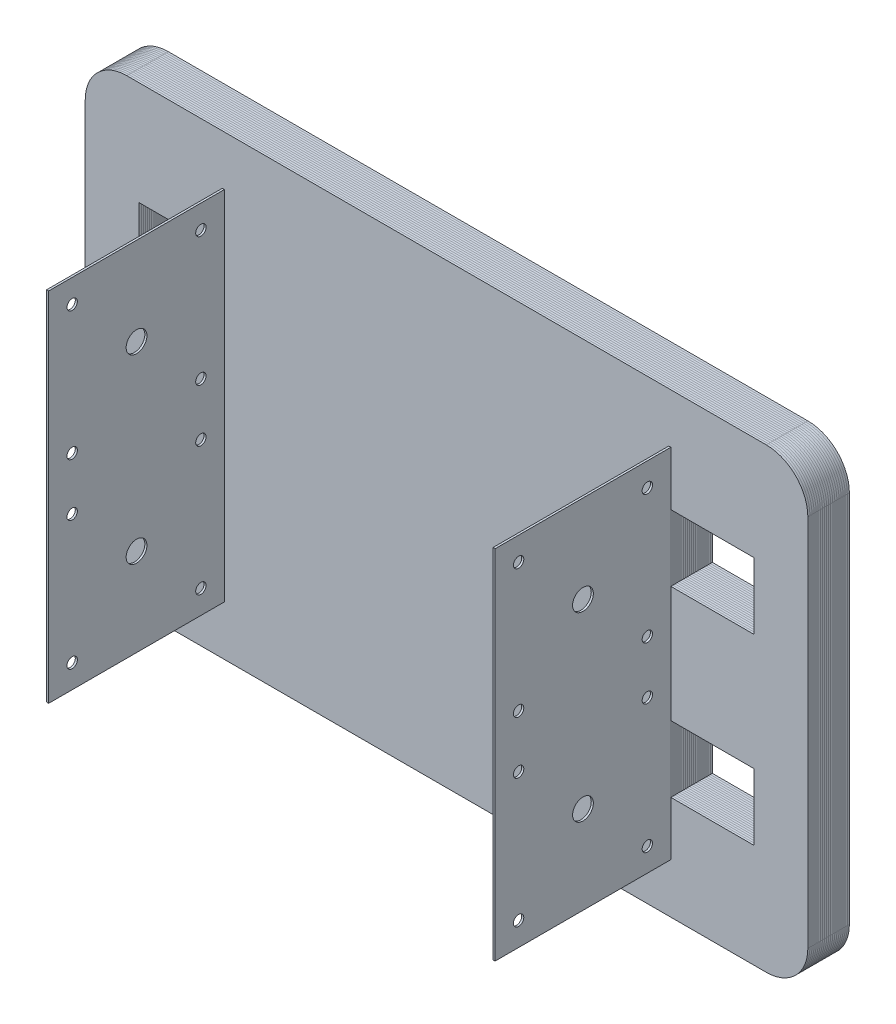
from build123d import *

# Parameters (mm, degrees)
ESBO_O2_W                                    = 20
ESBO_O2_H                                    = 16
RESSALTO_EXTRUS_O8_DEPTH                     = 0.5
ESBO_O2_13_W                                 = 0.5
ESBO_O2_13_H                                 = 86
RESSALTO_EXTRUS_O9_DEPTH                     = 42.3
RESSALTO_EXTRUS_O9_2_DEPTH                   = 42.3
BROCA_DE_ROSQUEAR_PARA_TARRAXA_DE_M3_2_COUNT = 2
BROCA_DE_ROSQUEAR_PARA_TARRAXA_DE_M3_2_PITCH = 31
BROCA_DE_ROSQUEAR_PARA_TARRAXA_DE_M3_3_COUNT = 2
BROCA_DE_ROSQUEAR_PARA_TARRAXA_DE_M3_3_PITCH = 43.840620434
BROCA_DE_ROSQUEAR_PARA_TARRAXA_DE_M3_4_COUNT = 2
BROCA_DE_ROSQUEAR_PARA_TARRAXA_DE_M3_4_PITCH = 31
BROCA_DE_ROSQUEAR_PARA_TARRAXA_DE_M3_5_COUNT = 2
BROCA_DE_ROSQUEAR_PARA_TARRAXA_DE_M3_5_PITCH = 53.578820442
BROCA_DE_ROSQUEAR_PARA_TARRAXA_DE_M3_6_COUNT = 2
BROCA_DE_ROSQUEAR_PARA_TARRAXA_DE_M3_6_PITCH = 43.7
BROCA_DE_ROSQUEAR_PARA_TARRAXA_DE_M3_7_COUNT = 2
BROCA_DE_ROSQUEAR_PARA_TARRAXA_DE_M3_7_PITCH = 74.7
BROCA_DE_ROSQUEAR_PARA_TARRAXA_DE_M3_8_COUNT = 2
BROCA_DE_ROSQUEAR_PARA_TARRAXA_DE_M3_8_PITCH = 80.877005385
CORTE_EXTRUS_O2_DEPTH                        = 184.766944797
CORTE_EXTRUS_O2_DEPTH_BACK                   = 184.766944797
ESBO_O27_R                                   = 1.25
ESBO_O27_R_2                                 = 2.5
CORTE_EXTRUS_O3_DEPTH                        = 184.766944797
CORTE_EXTRUS_O3_DEPTH_BACK                   = 184.766944797
ESBO_O27_2_R                                 = 1.25
ESBO_O27_2_R_2                               = 2.5
ESBO_O28_W                                   = 20
ESBO_O28_H                                   = 16
RESSALTO_EXTRUS_O10_DEPTH                    = 0.5
ESBO_O29_W                                   = 20
ESBO_O29_H                                   = 16
RESSALTO_EXTRUS_O11_DEPTH                    = 0.5
ESBO_O30_W                                   = 20
ESBO_O30_H                                   = 16
RESSALTO_EXTRUS_O12_DEPTH                    = 0.5
ESBO_O31_W                                   = 20
ESBO_O31_H                                   = 16
RESSALTO_EXTRUS_O13_DEPTH                    = 0.5
ESBO_O32_W                                   = 20
ESBO_O32_H                                   = 16
RESSALTO_EXTRUS_O14_DEPTH                    = 0.5
ESBO_O33_W                                   = 20
ESBO_O33_H                                   = 16
RESSALTO_EXTRUS_O15_DEPTH                    = 0.5
ESBO_O34_W                                   = 20
ESBO_O34_H                                   = 16
RESSALTO_EXTRUS_O16_DEPTH                    = 0.5
ESBO_O35_W                                   = 20
ESBO_O35_H                                   = 16
RESSALTO_EXTRUS_O17_DEPTH                    = 0.5
ESBO_O36_W                                   = 20
ESBO_O36_H                                   = 16
RESSALTO_EXTRUS_O18_DEPTH                    = 0.5
ESBO_O37_W                                   = 20
ESBO_O37_H                                   = 16
RESSALTO_EXTRUS_O19_DEPTH                    = 0.5
ESBO_O38_W                                   = 20
ESBO_O38_H                                   = 16
RESSALTO_EXTRUS_O20_DEPTH                    = 0.5
ESBO_O39_W                                   = 20
ESBO_O39_H                                   = 16
RESSALTO_EXTRUS_O21_DEPTH                    = 0.5
ESBO_O40_W                                   = 20
ESBO_O40_H                                   = 16
RESSALTO_EXTRUS_O22_DEPTH                    = 0.5
ESBO_O41_W                                   = 20
ESBO_O41_H                                   = 16
RESSALTO_EXTRUS_O23_DEPTH                    = 0.5
ESBO_O42_W                                   = 20
ESBO_O42_H                                   = 16
RESSALTO_EXTRUS_O24_DEPTH                    = 0.5
ESBO_O43_W                                   = 20
ESBO_O43_H                                   = 16
RESSALTO_EXTRUS_O25_DEPTH                    = 0.5
ESBO_O46_W                                   = 20
ESBO_O46_H                                   = 16
RESSALTO_EXTRUS_O27_DEPTH                    = 0.5
ESBO_O47_W                                   = 20
ESBO_O47_H                                   = 16
RESSALTO_EXTRUS_O28_DEPTH                    = 0.5
ESBO_O48_W                                   = 20
ESBO_O48_H                                   = 16
RESSALTO_EXTRUS_O30_DEPTH                    = 0.5


with BuildPart() as part:
    # Esboço2 → Ressalto-extrusão8 (new body)
    with BuildSketch(Plane.XY):
        with BuildLine():
            Line((-164, 0), (-10, 0))
            ThreePointArc((-10, 0), (-2.928932188, 2.928932188), (0, 10))
            Line((0, 10), (0, 100))
            ThreePointArc((0, 100), (-2.928932188, 107.071067812), (-10, 110))
            Line((-10, 110), (-164, 110))
            ThreePointArc((-164, 110), (-171.071067812, 107.071067812), (-174, 100))
            Line((-174, 100), (-174, 10))
            ThreePointArc((-174, 10), (-171.071067812, 2.928932188), (-164, 0))
        make_face()
        with Locations((-151, 77)):
            Rectangle(ESBO_O2_W, ESBO_O2_H, mode=Mode.SUBTRACT)
        with Locations((-151, 33)):
            Rectangle(ESBO_O2_W, ESBO_O2_H, mode=Mode.SUBTRACT)
        with Locations((-23, 33)):
            Rectangle(ESBO_O2_W, ESBO_O2_H, mode=Mode.SUBTRACT)
        with Locations((-23, 77)):
            Rectangle(ESBO_O2_W, ESBO_O2_H, mode=Mode.SUBTRACT)
    extrude(amount=-RESSALTO_EXTRUS_O8_DEPTH)


with BuildPart() as body_2:
    # Esboço2<13> → Ressalto-extrusão9 (new body)
    with BuildSketch(Plane.XY):
        with Locations((-33.25, 55)):
            Rectangle(ESBO_O2_13_W, ESBO_O2_13_H)
    extrude(amount=RESSALTO_EXTRUS_O9_DEPTH)

    # Esboço27 → Corte-extrusão2 (cut, two sides: drawn at the far end of the back side and taken through both)
    with BuildSketch(Plane.ZY.offset(141).offset(-CORTE_EXTRUS_O2_DEPTH_BACK)):
        with Locations((5.65, 92.35)):
            Circle(ESBO_O27_R)
        with Locations((36.65, 92.35)):
            Circle(ESBO_O27_R)
        with Locations((5.65, 61.35)):
            Circle(ESBO_O27_R)
        with Locations((36.65, 61.35)):
            Circle(ESBO_O27_R)
        with Locations((5.65, 48.65)):
            Circle(ESBO_O27_R)
        with Locations((36.65, 48.65)):
            Circle(ESBO_O27_R)
        with Locations((5.65, 17.65)):
            Circle(ESBO_O27_R)
        with Locations((36.65, 17.65)):
            Circle(ESBO_O27_R)
        with Locations((21.15, 76.85)):
            Circle(ESBO_O27_R_2)
        with Locations((21.15, 33.15)):
            Circle(ESBO_O27_R_2)
    extrude(amount=CORTE_EXTRUS_O2_DEPTH + CORTE_EXTRUS_O2_DEPTH_BACK, mode=Mode.SUBTRACT)


with BuildPart() as body_3:
    # Esboço2<13> → Ressalto-extrus_o9 2 (new body)
    with BuildSketch(Plane.XY):
        with Locations((-140.75, 55)):
            Rectangle(ESBO_O2_13_W, ESBO_O2_13_H)
    extrude(amount=RESSALTO_EXTRUS_O9_2_DEPTH)

    # Esboço26 → Broca de rosquear para tarraxa de M3x0.51 (revolve, cut)
    with BuildSketch(Plane(origin=(-141, 92.35, 36.65), x_dir=(0, 0, 1), z_dir=(0, 1, 0))):
        Polygon((0, 0), (0, 25.4), (1.25, 24.648924226), (1.25, 0), align=None)
    broca_de_rosquear_para_tarraxa_de_m3x0_5 = revolve(axis=Axis((-147.35, 92.35, 36.65), (1, 0, 0)), mode=Mode.SUBTRACT)

    # Broca de rosquear para tarraxa de M3 2: Broca de rosquear para tarraxa de M3x0.51 ×2
    with Locations(*[(0, 0, -i * BROCA_DE_ROSQUEAR_PARA_TARRAXA_DE_M3_2_PITCH) for i in range(1, BROCA_DE_ROSQUEAR_PARA_TARRAXA_DE_M3_2_COUNT)]):
        add(broca_de_rosquear_para_tarraxa_de_m3x0_5, mode=Mode.SUBTRACT)

    # Broca de rosquear para tarraxa de M3 3: Broca de rosquear para tarraxa de M3x0.51 ×2
    with Locations(*[Vector(0, -0.7071067811865476, -0.7071067811865475) * (i * BROCA_DE_ROSQUEAR_PARA_TARRAXA_DE_M3_3_PITCH) for i in range(1, BROCA_DE_ROSQUEAR_PARA_TARRAXA_DE_M3_3_COUNT)]):
        add(broca_de_rosquear_para_tarraxa_de_m3x0_5, mode=Mode.SUBTRACT)

    # Broca de rosquear para tarraxa de M3 4: Broca de rosquear para tarraxa de M3x0.51 ×2
    with Locations(*[(0, -i * BROCA_DE_ROSQUEAR_PARA_TARRAXA_DE_M3_4_PITCH, 0) for i in range(1, BROCA_DE_ROSQUEAR_PARA_TARRAXA_DE_M3_4_COUNT)]):
        add(broca_de_rosquear_para_tarraxa_de_m3x0_5, mode=Mode.SUBTRACT)

    # Broca de rosquear para tarraxa de M3 5: Broca de rosquear para tarraxa de M3x0.51 ×2
    with Locations(*[Vector(0, -0.8156207926781761, -0.578586832334632) * (i * BROCA_DE_ROSQUEAR_PARA_TARRAXA_DE_M3_5_PITCH) for i in range(1, BROCA_DE_ROSQUEAR_PARA_TARRAXA_DE_M3_5_COUNT)]):
        add(broca_de_rosquear_para_tarraxa_de_m3x0_5, mode=Mode.SUBTRACT)

    # Broca de rosquear para tarraxa de M3 6: Broca de rosquear para tarraxa de M3x0.51 ×2
    with Locations(*[(0, -i * BROCA_DE_ROSQUEAR_PARA_TARRAXA_DE_M3_6_PITCH, 0) for i in range(1, BROCA_DE_ROSQUEAR_PARA_TARRAXA_DE_M3_6_COUNT)]):
        add(broca_de_rosquear_para_tarraxa_de_m3x0_5, mode=Mode.SUBTRACT)

    # Broca de rosquear para tarraxa de M3 7: Broca de rosquear para tarraxa de M3x0.51 ×2
    with Locations(*[(0, -i * BROCA_DE_ROSQUEAR_PARA_TARRAXA_DE_M3_7_PITCH, 0) for i in range(1, BROCA_DE_ROSQUEAR_PARA_TARRAXA_DE_M3_7_COUNT)]):
        add(broca_de_rosquear_para_tarraxa_de_m3x0_5, mode=Mode.SUBTRACT)

    # Broca de rosquear para tarraxa de M3 8: Broca de rosquear para tarraxa de M3x0.51 ×2
    with Locations(*[Vector(0, -0.9236247020356809, -0.383298069117886) * (i * BROCA_DE_ROSQUEAR_PARA_TARRAXA_DE_M3_8_PITCH) for i in range(1, BROCA_DE_ROSQUEAR_PARA_TARRAXA_DE_M3_8_COUNT)]):
        add(broca_de_rosquear_para_tarraxa_de_m3x0_5, mode=Mode.SUBTRACT)

    # Esboço27<2> → Corte-extrusão3 (cut, two sides: drawn at the far end of the back side and taken through both)
    with BuildSketch(Plane.ZY.offset(141).offset(-CORTE_EXTRUS_O3_DEPTH_BACK)):
        with Locations((5.65, 92.35)):
            Circle(ESBO_O27_2_R)
        with Locations((36.65, 92.35)):
            Circle(ESBO_O27_2_R)
        with Locations((5.65, 61.35)):
            Circle(ESBO_O27_2_R)
        with Locations((36.65, 61.35)):
            Circle(ESBO_O27_2_R)
        with Locations((5.65, 48.65)):
            Circle(ESBO_O27_2_R)
        with Locations((36.65, 48.65)):
            Circle(ESBO_O27_2_R)
        with Locations((5.65, 17.65)):
            Circle(ESBO_O27_2_R)
        with Locations((36.65, 17.65)):
            Circle(ESBO_O27_2_R)
        with Locations((21.15, 76.85)):
            Circle(ESBO_O27_2_R_2)
        with Locations((21.15, 33.15)):
            Circle(ESBO_O27_2_R_2)
    extrude(amount=CORTE_EXTRUS_O3_DEPTH + CORTE_EXTRUS_O3_DEPTH_BACK, mode=Mode.SUBTRACT)


with BuildPart() as body_4:
    # Esboço28 → Ressalto-extrusão10 (new body)
    with BuildSketch(Plane(origin=(0, 0, -0.5), x_dir=(-1, 0, 0), z_dir=(0, 0, -1))):
        with BuildLine():
            Line((10, 110), (164, 110))
            ThreePointArc((164, 110), (171.071067812, 107.071067812), (174, 100))
            Line((174, 100), (174, 10))
            ThreePointArc((174, 10), (171.071067812, 2.928932188), (164, 0))
            Line((164, 0), (10, 0))
            ThreePointArc((10, 0), (2.928932188, 2.928932188), (0, 10))
            Line((0, 10), (0, 100))
            ThreePointArc((0, 100), (2.928932188, 107.071067812), (10, 110))
        make_face()
        with Locations((23, 77)):
            Rectangle(ESBO_O28_W, ESBO_O28_H, mode=Mode.SUBTRACT)
        with Locations((23, 33)):
            Rectangle(ESBO_O28_W, ESBO_O28_H, mode=Mode.SUBTRACT)
        with Locations((151, 77)):
            Rectangle(ESBO_O28_W, ESBO_O28_H, mode=Mode.SUBTRACT)
        with Locations((151, 33)):
            Rectangle(ESBO_O28_W, ESBO_O28_H, mode=Mode.SUBTRACT)
    extrude(amount=RESSALTO_EXTRUS_O10_DEPTH)


with BuildPart() as body_5:
    # Esboço29 → Ressalto-extrusão11 (new body)
    with BuildSketch(Plane(origin=(0, 0, -1), x_dir=(-1, 0, 0), z_dir=(0, 0, -1))):
        with BuildLine():
            Line((10, 110), (164, 110))
            ThreePointArc((164, 110), (171.071067812, 107.071067812), (174, 100))
            Line((174, 100), (174, 10))
            ThreePointArc((174, 10), (171.071067812, 2.928932188), (164, 0))
            Line((164, 0), (10, 0))
            ThreePointArc((10, 0), (2.928932188, 2.928932188), (0, 10))
            Line((0, 10), (0, 100))
            ThreePointArc((0, 100), (2.928932188, 107.071067812), (10, 110))
        make_face()
        with Locations((23, 77)):
            Rectangle(ESBO_O29_W, ESBO_O29_H, mode=Mode.SUBTRACT)
        with Locations((23, 33)):
            Rectangle(ESBO_O29_W, ESBO_O29_H, mode=Mode.SUBTRACT)
        with Locations((151, 77)):
            Rectangle(ESBO_O29_W, ESBO_O29_H, mode=Mode.SUBTRACT)
        with Locations((151, 33)):
            Rectangle(ESBO_O29_W, ESBO_O29_H, mode=Mode.SUBTRACT)
    extrude(amount=RESSALTO_EXTRUS_O11_DEPTH)


with BuildPart() as body_6:
    # Esboço30 → Ressalto-extrusão12 (new body)
    with BuildSketch(Plane(origin=(0, 0, -1.5), x_dir=(-1, 0, 0), z_dir=(0, 0, -1))):
        with BuildLine():
            Line((10, 110), (164, 110))
            ThreePointArc((164, 110), (171.071067812, 107.071067812), (174, 100))
            Line((174, 100), (174, 10))
            ThreePointArc((174, 10), (171.071067812, 2.928932188), (164, 0))
            Line((164, 0), (10, 0))
            ThreePointArc((10, 0), (2.928932188, 2.928932188), (0, 10))
            Line((0, 10), (0, 100))
            ThreePointArc((0, 100), (2.928932188, 107.071067812), (10, 110))
        make_face()
        with Locations((23, 77)):
            Rectangle(ESBO_O30_W, ESBO_O30_H, mode=Mode.SUBTRACT)
        with Locations((23, 33)):
            Rectangle(ESBO_O30_W, ESBO_O30_H, mode=Mode.SUBTRACT)
        with Locations((151, 77)):
            Rectangle(ESBO_O30_W, ESBO_O30_H, mode=Mode.SUBTRACT)
        with Locations((151, 33)):
            Rectangle(ESBO_O30_W, ESBO_O30_H, mode=Mode.SUBTRACT)
    extrude(amount=RESSALTO_EXTRUS_O12_DEPTH)


with BuildPart() as body_7:
    # Esboço31 → Ressalto-extrusão13 (new body)
    with BuildSketch(Plane(origin=(0, 0, -2), x_dir=(-1, 0, 0), z_dir=(0, 0, -1))):
        with BuildLine():
            Line((10, 110), (164, 110))
            ThreePointArc((164, 110), (171.071067812, 107.071067812), (174, 100))
            Line((174, 100), (174, 10))
            ThreePointArc((174, 10), (171.071067812, 2.928932188), (164, 0))
            Line((164, 0), (10, 0))
            ThreePointArc((10, 0), (2.928932188, 2.928932188), (0, 10))
            Line((0, 10), (0, 100))
            ThreePointArc((0, 100), (2.928932188, 107.071067812), (10, 110))
        make_face()
        with Locations((23, 77)):
            Rectangle(ESBO_O31_W, ESBO_O31_H, mode=Mode.SUBTRACT)
        with Locations((23, 33)):
            Rectangle(ESBO_O31_W, ESBO_O31_H, mode=Mode.SUBTRACT)
        with Locations((151, 77)):
            Rectangle(ESBO_O31_W, ESBO_O31_H, mode=Mode.SUBTRACT)
        with Locations((151, 33)):
            Rectangle(ESBO_O31_W, ESBO_O31_H, mode=Mode.SUBTRACT)
    extrude(amount=RESSALTO_EXTRUS_O13_DEPTH)


with BuildPart() as body_8:
    # Esboço32 → Ressalto-extrusão14 (new body)
    with BuildSketch(Plane(origin=(0, 0, -2.5), x_dir=(-1, 0, 0), z_dir=(0, 0, -1))):
        with BuildLine():
            Line((10, 110), (164, 110))
            ThreePointArc((164, 110), (171.071067812, 107.071067812), (174, 100))
            Line((174, 100), (174, 10))
            ThreePointArc((174, 10), (171.071067812, 2.928932188), (164, 0))
            Line((164, 0), (10, 0))
            ThreePointArc((10, 0), (2.928932188, 2.928932188), (0, 10))
            Line((0, 10), (0, 100))
            ThreePointArc((0, 100), (2.928932188, 107.071067812), (10, 110))
        make_face()
        with Locations((23, 77)):
            Rectangle(ESBO_O32_W, ESBO_O32_H, mode=Mode.SUBTRACT)
        with Locations((23, 33)):
            Rectangle(ESBO_O32_W, ESBO_O32_H, mode=Mode.SUBTRACT)
        with Locations((151, 77)):
            Rectangle(ESBO_O32_W, ESBO_O32_H, mode=Mode.SUBTRACT)
        with Locations((151, 33)):
            Rectangle(ESBO_O32_W, ESBO_O32_H, mode=Mode.SUBTRACT)
    extrude(amount=RESSALTO_EXTRUS_O14_DEPTH)


with BuildPart() as body_9:
    # Esboço33 → Ressalto-extrusão15 (new body)
    with BuildSketch(Plane(origin=(0, 0, -3), x_dir=(-1, 0, 0), z_dir=(0, 0, -1))):
        with BuildLine():
            Line((10, 110), (164, 110))
            ThreePointArc((164, 110), (171.071067812, 107.071067812), (174, 100))
            Line((174, 100), (174, 10))
            ThreePointArc((174, 10), (171.071067812, 2.928932188), (164, 0))
            Line((164, 0), (10, 0))
            ThreePointArc((10, 0), (2.928932188, 2.928932188), (0, 10))
            Line((0, 10), (0, 100))
            ThreePointArc((0, 100), (2.928932188, 107.071067812), (10, 110))
        make_face()
        with Locations((23, 77)):
            Rectangle(ESBO_O33_W, ESBO_O33_H, mode=Mode.SUBTRACT)
        with Locations((23, 33)):
            Rectangle(ESBO_O33_W, ESBO_O33_H, mode=Mode.SUBTRACT)
        with Locations((151, 77)):
            Rectangle(ESBO_O33_W, ESBO_O33_H, mode=Mode.SUBTRACT)
        with Locations((151, 33)):
            Rectangle(ESBO_O33_W, ESBO_O33_H, mode=Mode.SUBTRACT)
    extrude(amount=RESSALTO_EXTRUS_O15_DEPTH)


with BuildPart() as body_10:
    # Esboço34 → Ressalto-extrusão16 (new body)
    with BuildSketch(Plane(origin=(0, 0, -3.5), x_dir=(-1, 0, 0), z_dir=(0, 0, -1))):
        with BuildLine():
            Line((10, 110), (164, 110))
            ThreePointArc((164, 110), (171.071067812, 107.071067812), (174, 100))
            Line((174, 100), (174, 10))
            ThreePointArc((174, 10), (171.071067812, 2.928932188), (164, 0))
            Line((164, 0), (10, 0))
            ThreePointArc((10, 0), (2.928932188, 2.928932188), (0, 10))
            Line((0, 10), (0, 100))
            ThreePointArc((0, 100), (2.928932188, 107.071067812), (10, 110))
        make_face()
        with Locations((23, 77)):
            Rectangle(ESBO_O34_W, ESBO_O34_H, mode=Mode.SUBTRACT)
        with Locations((23, 33)):
            Rectangle(ESBO_O34_W, ESBO_O34_H, mode=Mode.SUBTRACT)
        with Locations((151, 77)):
            Rectangle(ESBO_O34_W, ESBO_O34_H, mode=Mode.SUBTRACT)
        with Locations((151, 33)):
            Rectangle(ESBO_O34_W, ESBO_O34_H, mode=Mode.SUBTRACT)
    extrude(amount=RESSALTO_EXTRUS_O16_DEPTH)


with BuildPart() as body_11:
    # Esboço35 → Ressalto-extrusão17 (new body)
    with BuildSketch(Plane(origin=(0, 0, -4), x_dir=(-1, 0, 0), z_dir=(0, 0, -1))):
        with BuildLine():
            Line((10, 110), (164, 110))
            ThreePointArc((164, 110), (171.071067812, 107.071067812), (174, 100))
            Line((174, 100), (174, 10))
            ThreePointArc((174, 10), (171.071067812, 2.928932188), (164, 0))
            Line((164, 0), (10, 0))
            ThreePointArc((10, 0), (2.928932188, 2.928932188), (0, 10))
            Line((0, 10), (0, 100))
            ThreePointArc((0, 100), (2.928932188, 107.071067812), (10, 110))
        make_face()
        with Locations((23, 77)):
            Rectangle(ESBO_O35_W, ESBO_O35_H, mode=Mode.SUBTRACT)
        with Locations((23, 33)):
            Rectangle(ESBO_O35_W, ESBO_O35_H, mode=Mode.SUBTRACT)
        with Locations((151, 77)):
            Rectangle(ESBO_O35_W, ESBO_O35_H, mode=Mode.SUBTRACT)
        with Locations((151, 33)):
            Rectangle(ESBO_O35_W, ESBO_O35_H, mode=Mode.SUBTRACT)
    extrude(amount=RESSALTO_EXTRUS_O17_DEPTH)


with BuildPart() as body_12:
    # Esboço36 → Ressalto-extrusão18 (new body)
    with BuildSketch(Plane(origin=(0, 0, -4.5), x_dir=(-1, 0, 0), z_dir=(0, 0, -1))):
        with BuildLine():
            Line((10, 110), (164, 110))
            ThreePointArc((164, 110), (171.071067812, 107.071067812), (174, 100))
            Line((174, 100), (174, 10))
            ThreePointArc((174, 10), (171.071067812, 2.928932188), (164, 0))
            Line((164, 0), (10, 0))
            ThreePointArc((10, 0), (2.928932188, 2.928932188), (0, 10))
            Line((0, 10), (0, 100))
            ThreePointArc((0, 100), (2.928932188, 107.071067812), (10, 110))
        make_face()
        with Locations((23, 77)):
            Rectangle(ESBO_O36_W, ESBO_O36_H, mode=Mode.SUBTRACT)
        with Locations((23, 33)):
            Rectangle(ESBO_O36_W, ESBO_O36_H, mode=Mode.SUBTRACT)
        with Locations((151, 77)):
            Rectangle(ESBO_O36_W, ESBO_O36_H, mode=Mode.SUBTRACT)
        with Locations((151, 33)):
            Rectangle(ESBO_O36_W, ESBO_O36_H, mode=Mode.SUBTRACT)
    extrude(amount=RESSALTO_EXTRUS_O18_DEPTH)


with BuildPart() as body_13:
    # Esboço37 → Ressalto-extrusão19 (new body)
    with BuildSketch(Plane(origin=(0, 0, -5), x_dir=(-1, 0, 0), z_dir=(0, 0, -1))):
        with BuildLine():
            Line((10, 110), (164, 110))
            ThreePointArc((164, 110), (171.071067812, 107.071067812), (174, 100))
            Line((174, 100), (174, 10))
            ThreePointArc((174, 10), (171.071067812, 2.928932188), (164, 0))
            Line((164, 0), (10, 0))
            ThreePointArc((10, 0), (2.928932188, 2.928932188), (0, 10))
            Line((0, 10), (0, 100))
            ThreePointArc((0, 100), (2.928932188, 107.071067812), (10, 110))
        make_face()
        with Locations((23, 77)):
            Rectangle(ESBO_O37_W, ESBO_O37_H, mode=Mode.SUBTRACT)
        with Locations((23, 33)):
            Rectangle(ESBO_O37_W, ESBO_O37_H, mode=Mode.SUBTRACT)
        with Locations((151, 77)):
            Rectangle(ESBO_O37_W, ESBO_O37_H, mode=Mode.SUBTRACT)
        with Locations((151, 33)):
            Rectangle(ESBO_O37_W, ESBO_O37_H, mode=Mode.SUBTRACT)
    extrude(amount=RESSALTO_EXTRUS_O19_DEPTH)


with BuildPart() as body_14:
    # Esboço38 → Ressalto-extrusão20 (new body)
    with BuildSketch(Plane(origin=(0, 0, -5.5), x_dir=(-1, 0, 0), z_dir=(0, 0, -1))):
        with BuildLine():
            Line((10, 110), (164, 110))
            ThreePointArc((164, 110), (171.071067812, 107.071067812), (174, 100))
            Line((174, 100), (174, 10))
            ThreePointArc((174, 10), (171.071067812, 2.928932188), (164, 0))
            Line((164, 0), (10, 0))
            ThreePointArc((10, 0), (2.928932188, 2.928932188), (0, 10))
            Line((0, 10), (0, 100))
            ThreePointArc((0, 100), (2.928932188, 107.071067812), (10, 110))
        make_face()
        with Locations((23, 77)):
            Rectangle(ESBO_O38_W, ESBO_O38_H, mode=Mode.SUBTRACT)
        with Locations((23, 33)):
            Rectangle(ESBO_O38_W, ESBO_O38_H, mode=Mode.SUBTRACT)
        with Locations((151, 77)):
            Rectangle(ESBO_O38_W, ESBO_O38_H, mode=Mode.SUBTRACT)
        with Locations((151, 33)):
            Rectangle(ESBO_O38_W, ESBO_O38_H, mode=Mode.SUBTRACT)
    extrude(amount=RESSALTO_EXTRUS_O20_DEPTH)


with BuildPart() as body_15:
    # Esboço39 → Ressalto-extrusão21 (new body)
    with BuildSketch(Plane(origin=(0, 0, -6), x_dir=(-1, 0, 0), z_dir=(0, 0, -1))):
        with BuildLine():
            Line((10, 110), (164, 110))
            ThreePointArc((164, 110), (171.071067812, 107.071067812), (174, 100))
            Line((174, 100), (174, 10))
            ThreePointArc((174, 10), (171.071067812, 2.928932188), (164, 0))
            Line((164, 0), (10, 0))
            ThreePointArc((10, 0), (2.928932188, 2.928932188), (0, 10))
            Line((0, 10), (0, 100))
            ThreePointArc((0, 100), (2.928932188, 107.071067812), (10, 110))
        make_face()
        with Locations((23, 77)):
            Rectangle(ESBO_O39_W, ESBO_O39_H, mode=Mode.SUBTRACT)
        with Locations((23, 33)):
            Rectangle(ESBO_O39_W, ESBO_O39_H, mode=Mode.SUBTRACT)
        with Locations((151, 77)):
            Rectangle(ESBO_O39_W, ESBO_O39_H, mode=Mode.SUBTRACT)
        with Locations((151, 33)):
            Rectangle(ESBO_O39_W, ESBO_O39_H, mode=Mode.SUBTRACT)
    extrude(amount=RESSALTO_EXTRUS_O21_DEPTH)


with BuildPart() as body_16:
    # Esboço40 → Ressalto-extrusão22 (new body)
    with BuildSketch(Plane(origin=(0, 0, -6.5), x_dir=(-1, 0, 0), z_dir=(0, 0, -1))):
        with BuildLine():
            Line((10, 110), (164, 110))
            ThreePointArc((164, 110), (171.071067812, 107.071067812), (174, 100))
            Line((174, 100), (174, 10))
            ThreePointArc((174, 10), (171.071067812, 2.928932188), (164, 0))
            Line((164, 0), (10, 0))
            ThreePointArc((10, 0), (2.928932188, 2.928932188), (0, 10))
            Line((0, 10), (0, 100))
            ThreePointArc((0, 100), (2.928932188, 107.071067812), (10, 110))
        make_face()
        with Locations((23, 77)):
            Rectangle(ESBO_O40_W, ESBO_O40_H, mode=Mode.SUBTRACT)
        with Locations((23, 33)):
            Rectangle(ESBO_O40_W, ESBO_O40_H, mode=Mode.SUBTRACT)
        with Locations((151, 77)):
            Rectangle(ESBO_O40_W, ESBO_O40_H, mode=Mode.SUBTRACT)
        with Locations((151, 33)):
            Rectangle(ESBO_O40_W, ESBO_O40_H, mode=Mode.SUBTRACT)
    extrude(amount=RESSALTO_EXTRUS_O22_DEPTH)


with BuildPart() as body_17:
    # Esboço41 → Ressalto-extrusão23 (new body)
    with BuildSketch(Plane(origin=(0, 0, -7), x_dir=(-1, 0, 0), z_dir=(0, 0, -1))):
        with BuildLine():
            Line((10, 110), (164, 110))
            ThreePointArc((164, 110), (171.071067812, 107.071067812), (174, 100))
            Line((174, 100), (174, 10))
            ThreePointArc((174, 10), (171.071067812, 2.928932188), (164, 0))
            Line((164, 0), (10, 0))
            ThreePointArc((10, 0), (2.928932188, 2.928932188), (0, 10))
            Line((0, 10), (0, 100))
            ThreePointArc((0, 100), (2.928932188, 107.071067812), (10, 110))
        make_face()
        with Locations((23, 77)):
            Rectangle(ESBO_O41_W, ESBO_O41_H, mode=Mode.SUBTRACT)
        with Locations((23, 33)):
            Rectangle(ESBO_O41_W, ESBO_O41_H, mode=Mode.SUBTRACT)
        with Locations((151, 77)):
            Rectangle(ESBO_O41_W, ESBO_O41_H, mode=Mode.SUBTRACT)
        with Locations((151, 33)):
            Rectangle(ESBO_O41_W, ESBO_O41_H, mode=Mode.SUBTRACT)
    extrude(amount=RESSALTO_EXTRUS_O23_DEPTH)


with BuildPart() as body_18:
    # Esboço42 → Ressalto-extrusão24 (new body)
    with BuildSketch(Plane(origin=(0, 0, -7.5), x_dir=(-1, 0, 0), z_dir=(0, 0, -1))):
        with BuildLine():
            Line((10, 110), (164, 110))
            ThreePointArc((164, 110), (171.071067812, 107.071067812), (174, 100))
            Line((174, 100), (174, 10))
            ThreePointArc((174, 10), (171.071067812, 2.928932188), (164, 0))
            Line((164, 0), (10, 0))
            ThreePointArc((10, 0), (2.928932188, 2.928932188), (0, 10))
            Line((0, 10), (0, 100))
            ThreePointArc((0, 100), (2.928932188, 107.071067812), (10, 110))
        make_face()
        with Locations((23, 77)):
            Rectangle(ESBO_O42_W, ESBO_O42_H, mode=Mode.SUBTRACT)
        with Locations((23, 33)):
            Rectangle(ESBO_O42_W, ESBO_O42_H, mode=Mode.SUBTRACT)
        with Locations((151, 77)):
            Rectangle(ESBO_O42_W, ESBO_O42_H, mode=Mode.SUBTRACT)
        with Locations((151, 33)):
            Rectangle(ESBO_O42_W, ESBO_O42_H, mode=Mode.SUBTRACT)
    extrude(amount=RESSALTO_EXTRUS_O24_DEPTH)


with BuildPart() as body_19:
    # Esboço43 → Ressalto-extrusão25 (new body)
    with BuildSketch(Plane(origin=(0, 0, -8), x_dir=(-1, 0, 0), z_dir=(0, 0, -1))):
        with BuildLine():
            Line((10, 110), (164, 110))
            ThreePointArc((164, 110), (171.071067812, 107.071067812), (174, 100))
            Line((174, 100), (174, 10))
            ThreePointArc((174, 10), (171.071067812, 2.928932188), (164, 0))
            Line((164, 0), (10, 0))
            ThreePointArc((10, 0), (2.928932188, 2.928932188), (0, 10))
            Line((0, 10), (0, 100))
            ThreePointArc((0, 100), (2.928932188, 107.071067812), (10, 110))
        make_face()
        with Locations((23, 77)):
            Rectangle(ESBO_O43_W, ESBO_O43_H, mode=Mode.SUBTRACT)
        with Locations((23, 33)):
            Rectangle(ESBO_O43_W, ESBO_O43_H, mode=Mode.SUBTRACT)
        with Locations((151, 77)):
            Rectangle(ESBO_O43_W, ESBO_O43_H, mode=Mode.SUBTRACT)
        with Locations((151, 33)):
            Rectangle(ESBO_O43_W, ESBO_O43_H, mode=Mode.SUBTRACT)
    extrude(amount=RESSALTO_EXTRUS_O25_DEPTH)


with BuildPart() as body_20:
    # Esboço46 → Ressalto-extrusão27 (new body)
    with BuildSketch(Plane(origin=(0, 0, -8.5), x_dir=(-1, 0, 0), z_dir=(0, 0, -1))):
        with BuildLine():
            Line((10, 110), (164, 110))
            ThreePointArc((164, 110), (171.071067812, 107.071067812), (174, 100))
            Line((174, 100), (174, 10))
            ThreePointArc((174, 10), (171.071067812, 2.928932188), (164, 0))
            Line((164, 0), (10, 0))
            ThreePointArc((10, 0), (2.928932188, 2.928932188), (0, 10))
            Line((0, 10), (0, 100))
            ThreePointArc((0, 100), (2.928932188, 107.071067812), (10, 110))
        make_face()
        with Locations((23, 77)):
            Rectangle(ESBO_O46_W, ESBO_O46_H, mode=Mode.SUBTRACT)
        with Locations((23, 33)):
            Rectangle(ESBO_O46_W, ESBO_O46_H, mode=Mode.SUBTRACT)
        with Locations((151, 77)):
            Rectangle(ESBO_O46_W, ESBO_O46_H, mode=Mode.SUBTRACT)
        with Locations((151, 33)):
            Rectangle(ESBO_O46_W, ESBO_O46_H, mode=Mode.SUBTRACT)
    extrude(amount=RESSALTO_EXTRUS_O27_DEPTH)


with BuildPart() as body_21:
    # Esboço47 → Ressalto-extrusão28 (new body)
    with BuildSketch(Plane(origin=(0, 0, -9), x_dir=(-1, 0, 0), z_dir=(0, 0, -1))):
        with BuildLine():
            Line((10, 110), (164, 110))
            ThreePointArc((164, 110), (171.071067812, 107.071067812), (174, 100))
            Line((174, 100), (174, 10))
            ThreePointArc((174, 10), (171.071067812, 2.928932188), (164, 0))
            Line((164, 0), (10, 0))
            ThreePointArc((10, 0), (2.928932188, 2.928932188), (0, 10))
            Line((0, 10), (0, 100))
            ThreePointArc((0, 100), (2.928932188, 107.071067812), (10, 110))
        make_face()
        with Locations((23, 77)):
            Rectangle(ESBO_O47_W, ESBO_O47_H, mode=Mode.SUBTRACT)
        with Locations((23, 33)):
            Rectangle(ESBO_O47_W, ESBO_O47_H, mode=Mode.SUBTRACT)
        with Locations((151, 77)):
            Rectangle(ESBO_O47_W, ESBO_O47_H, mode=Mode.SUBTRACT)
        with Locations((151, 33)):
            Rectangle(ESBO_O47_W, ESBO_O47_H, mode=Mode.SUBTRACT)
    extrude(amount=RESSALTO_EXTRUS_O28_DEPTH)


with BuildPart() as body_22:
    # Esboço48 → Ressalto-extrusão30 (new body)
    with BuildSketch(Plane(origin=(0, 0, -9.5), x_dir=(-1, 0, 0), z_dir=(0, 0, -1))):
        with BuildLine():
            Line((10, 110), (164, 110))
            ThreePointArc((164, 110), (171.071067812, 107.071067812), (174, 100))
            Line((174, 100), (174, 10))
            ThreePointArc((174, 10), (171.071067812, 2.928932188), (164, 0))
            Line((164, 0), (10, 0))
            ThreePointArc((10, 0), (2.928932188, 2.928932188), (0, 10))
            Line((0, 10), (0, 100))
            ThreePointArc((0, 100), (2.928932188, 107.071067812), (10, 110))
        make_face()
        with Locations((23, 77)):
            Rectangle(ESBO_O48_W, ESBO_O48_H, mode=Mode.SUBTRACT)
        with Locations((23, 33)):
            Rectangle(ESBO_O48_W, ESBO_O48_H, mode=Mode.SUBTRACT)
        with Locations((151, 77)):
            Rectangle(ESBO_O48_W, ESBO_O48_H, mode=Mode.SUBTRACT)
        with Locations((151, 33)):
            Rectangle(ESBO_O48_W, ESBO_O48_H, mode=Mode.SUBTRACT)
    extrude(amount=RESSALTO_EXTRUS_O30_DEPTH)


solid = Compound([part.part, body_2.part, body_3.part, body_4.part, body_5.part, body_6.part, body_7.part, body_8.part, body_9.part, body_10.part, body_11.part, body_12.part, body_13.part, body_14.part, body_15.part, body_16.part, body_17.part, body_18.part, body_19.part, body_20.part, body_21.part, body_22.part])
